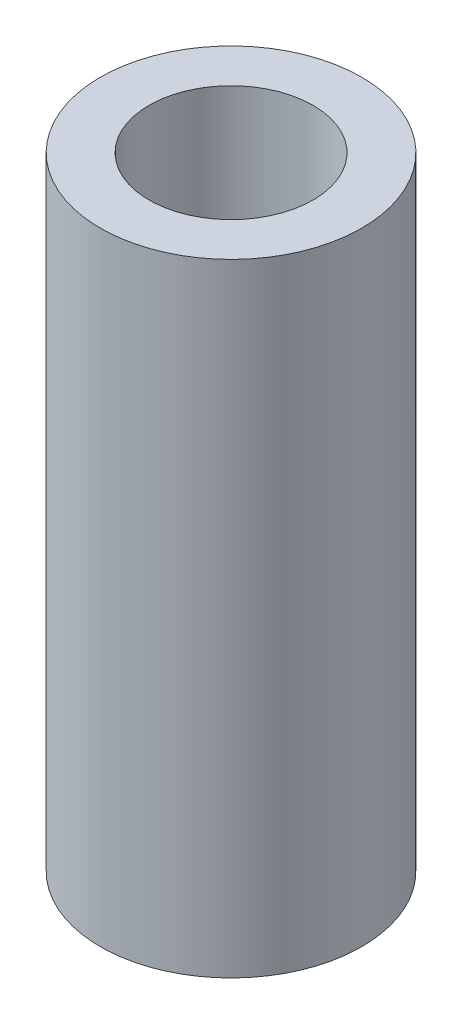
from build123d import *

# Parameters (mm, degrees)
SKETCH1_R           = 16.6751
SKETCH1_R_2         = 10.4648
BOSS_EXTRUDE1_DEPTH = 39.6875


with BuildPart() as part:
    # Sketch1 → Boss-Extrude1 (new, symmetric)
    with BuildSketch(Plane(origin=(0, 0, 0), x_dir=(1, 0, 0), z_dir=(0, 1, 0))):
        Circle(SKETCH1_R)
        Circle(SKETCH1_R_2, mode=Mode.SUBTRACT)
    extrude(amount=BOSS_EXTRUDE1_DEPTH, both=True)


solid = part.part
